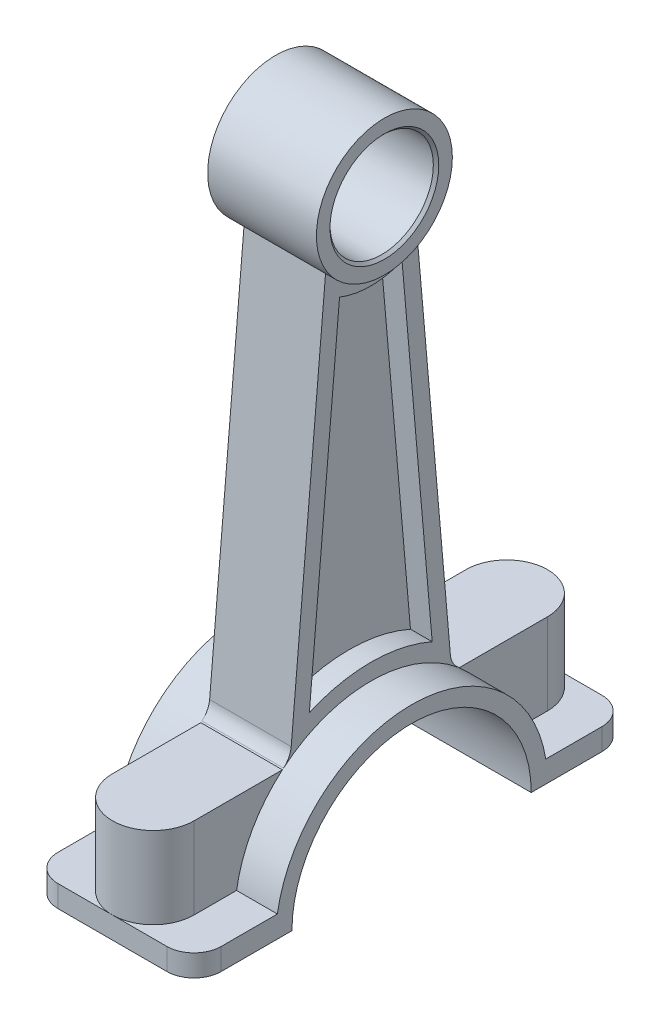
from build123d import *

# Parameters (mm, degrees)
BOSS_EXTRUDE1_DEPTH     = 15
BOSS_EXTRUDE2_DEPTH     = 7.5
SKETCH5_R               = 12.5
BOSS_EXTRUDE3_DEPTH     = 10
BOSS_EXTRUDE4_DEPTH     = 15
CUT_EXTRUDE2_DEPTH      = 126.139759491
CUT_EXTRUDE2_DEPTH_BACK = 126.139759491
SKETCH7_R               = 22
SKETCH7_R_2             = 9.5
CUT_EXTRUDE3_DEPTH      = 4
CHAMFER1_SIZE           = 0.5
FILLET1_R               = 5
FILLET2_R               = 4


with BuildPart() as part:
    # Sketch3 → Boss-Extrude1 (new, symmetric)
    with BuildSketch(Plane(origin=(0, 0, 0), x_dir=(0, 0, -1), z_dir=(1, 0, 0))):
        with BuildLine():
            Line((40, 0), (-40, 0))
            Line((-40, 0), (-40, 4))
            Line((-40, 4), (-24.677925359, 4))
            ThreePointArc((-24.677925359, 4), (0, 25), (24.677925359, 4))
            Line((24.677925359, 4), (40, 4))
            Line((40, 4), (40, 0))
        make_face()
    extrude(amount=BOSS_EXTRUDE1_DEPTH, both=True)

    # Sketch4 → Boss-Extrude2 (add, symmetric)
    with BuildSketch(Plane(origin=(0, 0, 0), x_dir=(0, 0, -1), z_dir=(1, 0, 0))):
        Polygon((7.5, 103.409272302), (16.54713903, 0), (-16.54713903, 0), (-7.5, 103.409272302), align=None)
    extrude(amount=BOSS_EXTRUDE2_DEPTH, both=True)

    # Sketch5 → Boss-Extrude3 (add, symmetric)
    with BuildSketch(Plane(origin=(0, 0, 0), x_dir=(0, 0, -1), z_dir=(1, 0, 0))):
        with Locations((0, 103.409272302)):
            Circle(SKETCH5_R)
    extrude(amount=BOSS_EXTRUDE3_DEPTH, both=True)

    # Sketch6 → Boss-Extrude4 (add)
    with BuildSketch(Plane(origin=(0, 4, 0), x_dir=(1, 0, 0), z_dir=(0, 1, 0))):
        with BuildLine():
            Line((-7.5, -32.5), (-7.5, 32.5))
            ThreePointArc((-7.5, 32.5), (0, 40), (7.5, 32.5))
            Line((7.5, 32.5), (7.5, -32.5))
            ThreePointArc((7.5, -32.5), (0, -40), (-7.5, -32.5))
        make_face()
    extrude(amount=BOSS_EXTRUDE4_DEPTH)

    # Sketch7 → Cut-Extrude2 (cut, two sides: drawn at the far end of the back side and taken through both)
    with BuildSketch(Plane(origin=(10, 0, 0), x_dir=(0, 0, -1), z_dir=(1, 0, 0)).offset(-CUT_EXTRUDE2_DEPTH_BACK)):
        Circle(SKETCH7_R)
        with Locations((0, 103.409272302)):
            Circle(SKETCH7_R_2)
    extrude(amount=CUT_EXTRUDE2_DEPTH + CUT_EXTRUDE2_DEPTH_BACK, mode=Mode.SUBTRACT)

    # Sketch13 → Cut-Extrude3 (cut)
    with BuildSketch(Plane(origin=(7.5, 0, 0), x_dir=(0, 0, -1), z_dir=(1, 0, 0))):
        with BuildLine():
            Line((-5.747925596, 89.014434639), (-11.294120161, 25.621140681))
            ThreePointArc((-11.294120161, 25.621140681), (0, 28), (11.294120161, 25.621140681))
            Line((11.294120161, 25.621140681), (5.747925596, 89.014434639))
            ThreePointArc((5.747925596, 89.014434639), (0, 87.909272302), (-5.747925596, 89.014434639))
        make_face()
    cut_extrude3 = extrude(amount=-CUT_EXTRUDE3_DEPTH, mode=Mode.SUBTRACT)

    # Mirror1: Cut-Extrude3 across plane
    add(cut_extrude3.mirror(Plane(origin=(0, 0, 0), x_dir=(0, 0, 1), z_dir=(1, 0, 0))), mode=Mode.SUBTRACT)

    # Chamfer1
    chamfer1_edges = [part.edges().sort_by_distance(p)[0] for p in [
        (-10, 103.409272302, 9.5),
        (10, 103.409272302, 9.5),
    ]]
    chamfer(chamfer1_edges, length=CHAMFER1_SIZE)

    # Fillet1
    fillet1_edges = [part.edges().sort_by_distance(p)[0] for p in [
        (-15, 2, -40),
        (15, 2, -40),
        (-15, 2, 40),
        (15, 2, 40),
    ]]
    fillet(fillet1_edges, radius=FILLET1_R)

    # Fillet2
    fillet2_edges = [part.edges().sort_by_distance(p)[0] for p in [
        (0, 20.16070078, -14.783306263),
        (0, 20.16070078, 14.783306263),
    ]]
    fillet(fillet2_edges, radius=FILLET2_R)


solid = part.part
